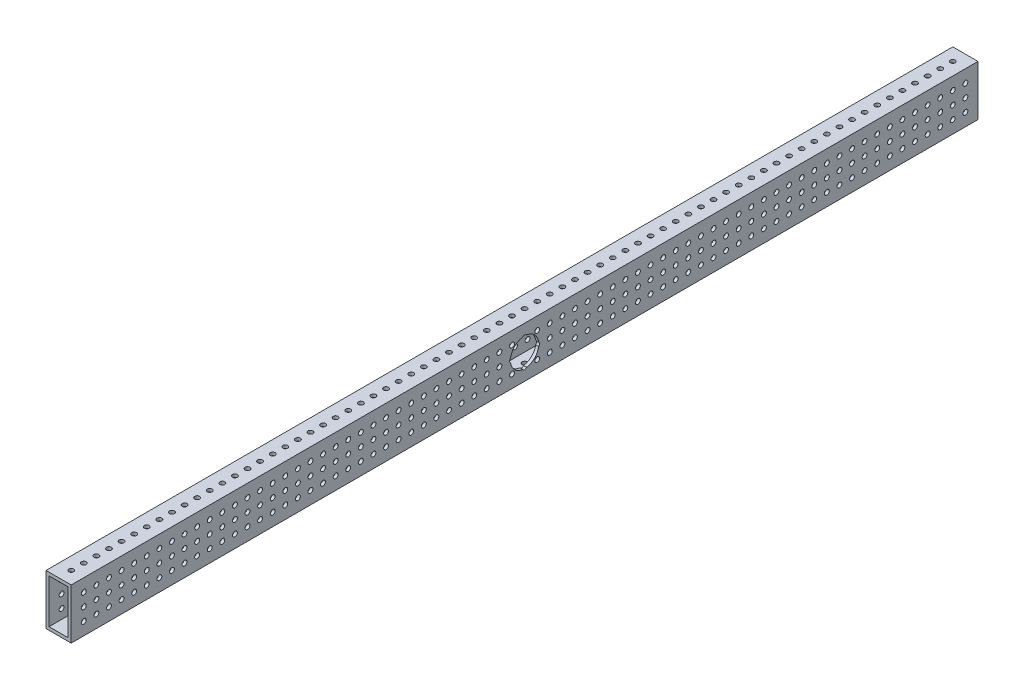
from build123d import *

# Parameters (mm, degrees)
SKETCH1_W             = 25.4
SKETCH1_H             = 50.8
SKETCH1_W_2           = 19.304
SKETCH1_H_2           = 44.45
BOSS_EXTRUDE1_DEPTH   = 457.2
SKETCH2_W             = 2.45745
SKETCH2_H             = 50.8
SKETCH2_AT_POINT_2_W  = 2.45745
SKETCH2_AT_POINT_2_H  = 50.8
SKETCH2_AT_POINT_3_W  = 2.45745
SKETCH2_AT_POINT_3_H  = 50.8
SKETCH2_AT_POINT_4_W  = 2.45745
SKETCH2_AT_POINT_4_H  = 50.8
LPATTERN1_START       = -12.7
LPATTERN1_OUTLINE_R   = 2.45745
LPATTERN1_DEPTH       = 25.4
LPATTERN1_START_2     = -25.4
LPATTERN1_2_OUTLINE_R = 2.45745
LPATTERN1_2_DEPTH     = 50.8
SKETCH3_R             = 14.2875
CUT_EXTRUDE1_DEPTH    = 459.608940166


with BuildPart() as part:
    # Sketch1 → Boss-Extrude1 (new, symmetric)
    with BuildSketch(Plane.XY):
        Rectangle(SKETCH1_W, SKETCH1_H)
        Rectangle(SKETCH1_W_2, SKETCH1_H_2, mode=Mode.SUBTRACT)
    extrude(amount=BOSS_EXTRUDE1_DEPTH, both=True)

    # Sketch2 → #10 (0.1935) Diameter Hole1 (revolve, cut)
    with BuildSketch(Plane(origin=(0, 25.4, 444.5), x_dir=(0, 0, 1), z_dir=(1, 0, 0))):
        with Locations((1.228725, 25.4)):
            Rectangle(SKETCH2_W, SKETCH2_H)
    revolve(axis=Axis((0, 31.75, 444.5), (0, -1, 0)), mode=Mode.SUBTRACT)

    # Sketch2 at point 2 (carried to point 2, square into its face) → #10 (0.1935) Diameter Hole1 at 2 (revolve, cut)
    with BuildSketch(Plane(origin=(12.7, 12.7, 444.5), x_dir=(0, 0, 1), z_dir=(0, -1, 0))):
        with Locations((1.228725, 25.4)):
            Rectangle(SKETCH2_AT_POINT_2_W, SKETCH2_AT_POINT_2_H)
    revolve(axis=Axis((19.05, 12.7, 444.5), (-1, 0, 0)), mode=Mode.SUBTRACT)

    # Sketch2 at point 3 (carried to point 3, square into its face) → #10 (0.1935) Diameter Hole1 at 3 (revolve, cut)
    with BuildSketch(Plane(origin=(12.7, 0, 444.5), x_dir=(0, 0, 1), z_dir=(0, -1, 0))):
        with Locations((1.228725, 25.4)):
            Rectangle(SKETCH2_AT_POINT_3_W, SKETCH2_AT_POINT_3_H)
    revolve(axis=Axis((19.05, 0, 444.5), (-1, 0, 0)), mode=Mode.SUBTRACT)

    # Sketch2 at point 4 (carried to point 4, square into its face) → #10 (0.1935) Diameter Hole1 at 4 (revolve, cut)
    with BuildSketch(Plane(origin=(12.7, -12.7, 444.5), x_dir=(0, 0, 1), z_dir=(0, -1, 0))):
        with Locations((1.228725, 25.4)):
            Rectangle(SKETCH2_AT_POINT_4_W, SKETCH2_AT_POINT_4_H)
    revolve(axis=Axis((19.05, -12.7, 444.5), (-1, 0, 0)), mode=Mode.SUBTRACT)

    # LPattern1: read off the stored shape, not the designer's step
    # LPattern1 outline → LPattern1 (cut)
    with BuildSketch(Plane.YZ.offset(LPATTERN1_START)):
        with Locations((-12.7, 431.8)):
            Circle(LPATTERN1_OUTLINE_R)
        with Locations((0, 431.8)):
            Circle(LPATTERN1_OUTLINE_R)
        with Locations((12.7, 431.8)):
            Circle(LPATTERN1_OUTLINE_R)
        with Locations((-12.7, 419.1)):
            Circle(LPATTERN1_OUTLINE_R)
        with Locations((0, 419.1)):
            Circle(LPATTERN1_OUTLINE_R)
        with Locations((12.7, 419.1)):
            Circle(LPATTERN1_OUTLINE_R)
        with Locations((-12.7, 406.4)):
            Circle(LPATTERN1_OUTLINE_R)
        with Locations((0, 406.4)):
            Circle(LPATTERN1_OUTLINE_R)
        with Locations((12.7, 406.4)):
            Circle(LPATTERN1_OUTLINE_R)
        with Locations((-12.7, 393.7)):
            Circle(LPATTERN1_OUTLINE_R)
        with Locations((0, 393.7)):
            Circle(LPATTERN1_OUTLINE_R)
        with Locations((12.7, 393.7)):
            Circle(LPATTERN1_OUTLINE_R)
        with Locations((-12.7, 381)):
            Circle(LPATTERN1_OUTLINE_R)
        with Locations((0, 381)):
            Circle(LPATTERN1_OUTLINE_R)
        with Locations((12.7, 381)):
            Circle(LPATTERN1_OUTLINE_R)
        with Locations((-12.7, 368.3)):
            Circle(LPATTERN1_OUTLINE_R)
        with Locations((0, 368.3)):
            Circle(LPATTERN1_OUTLINE_R)
        with Locations((12.7, 368.3)):
            Circle(LPATTERN1_OUTLINE_R)
        with Locations((-12.7, 355.6)):
            Circle(LPATTERN1_OUTLINE_R)
        with Locations((0, 355.6)):
            Circle(LPATTERN1_OUTLINE_R)
        with Locations((12.7, 355.6)):
            Circle(LPATTERN1_OUTLINE_R)
        with Locations((-12.7, 342.9)):
            Circle(LPATTERN1_OUTLINE_R)
        with Locations((0, 342.9)):
            Circle(LPATTERN1_OUTLINE_R)
        with Locations((12.7, 342.9)):
            Circle(LPATTERN1_OUTLINE_R)
        with Locations((-12.7, 330.2)):
            Circle(LPATTERN1_OUTLINE_R)
        with Locations((0, 330.2)):
            Circle(LPATTERN1_OUTLINE_R)
        with Locations((12.7, 330.2)):
            Circle(LPATTERN1_OUTLINE_R)
        with Locations((-12.7, 317.5)):
            Circle(LPATTERN1_OUTLINE_R)
        with Locations((0, 317.5)):
            Circle(LPATTERN1_OUTLINE_R)
        with Locations((12.7, 317.5)):
            Circle(LPATTERN1_OUTLINE_R)
        with Locations((-12.7, 304.8)):
            Circle(LPATTERN1_OUTLINE_R)
        with Locations((0, 304.8)):
            Circle(LPATTERN1_OUTLINE_R)
        with Locations((12.7, 304.8)):
            Circle(LPATTERN1_OUTLINE_R)
        with Locations((-12.7, 292.1)):
            Circle(LPATTERN1_OUTLINE_R)
        with Locations((0, 292.1)):
            Circle(LPATTERN1_OUTLINE_R)
        with Locations((12.7, 292.1)):
            Circle(LPATTERN1_OUTLINE_R)
        with Locations((-12.7, 279.4)):
            Circle(LPATTERN1_OUTLINE_R)
        with Locations((0, 279.4)):
            Circle(LPATTERN1_OUTLINE_R)
        with Locations((12.7, 279.4)):
            Circle(LPATTERN1_OUTLINE_R)
        with Locations((-12.7, 266.7)):
            Circle(LPATTERN1_OUTLINE_R)
        with Locations((0, 266.7)):
            Circle(LPATTERN1_OUTLINE_R)
        with Locations((12.7, 266.7)):
            Circle(LPATTERN1_OUTLINE_R)
        with Locations((-12.7, 254)):
            Circle(LPATTERN1_OUTLINE_R)
        with Locations((0, 254)):
            Circle(LPATTERN1_OUTLINE_R)
        with Locations((12.7, 254)):
            Circle(LPATTERN1_OUTLINE_R)
        with Locations((-12.7, 241.3)):
            Circle(LPATTERN1_OUTLINE_R)
        with Locations((0, 241.3)):
            Circle(LPATTERN1_OUTLINE_R)
        with Locations((12.7, 241.3)):
            Circle(LPATTERN1_OUTLINE_R)
        with Locations((-12.7, 228.6)):
            Circle(LPATTERN1_OUTLINE_R)
        with Locations((0, 228.6)):
            Circle(LPATTERN1_OUTLINE_R)
        with Locations((12.7, 228.6)):
            Circle(LPATTERN1_OUTLINE_R)
        with Locations((-12.7, 215.9)):
            Circle(LPATTERN1_OUTLINE_R)
        with Locations((0, 215.9)):
            Circle(LPATTERN1_OUTLINE_R)
        with Locations((12.7, 215.9)):
            Circle(LPATTERN1_OUTLINE_R)
        with Locations((-12.7, 203.2)):
            Circle(LPATTERN1_OUTLINE_R)
        with Locations((0, 203.2)):
            Circle(LPATTERN1_OUTLINE_R)
        with Locations((12.7, 203.2)):
            Circle(LPATTERN1_OUTLINE_R)
        with Locations((-12.7, 190.5)):
            Circle(LPATTERN1_OUTLINE_R)
        with Locations((0, 190.5)):
            Circle(LPATTERN1_OUTLINE_R)
        with Locations((12.7, 190.5)):
            Circle(LPATTERN1_OUTLINE_R)
        with Locations((-12.7, 177.8)):
            Circle(LPATTERN1_OUTLINE_R)
        with Locations((0, 177.8)):
            Circle(LPATTERN1_OUTLINE_R)
        with Locations((12.7, 177.8)):
            Circle(LPATTERN1_OUTLINE_R)
        with Locations((-12.7, 165.1)):
            Circle(LPATTERN1_OUTLINE_R)
        with Locations((0, 165.1)):
            Circle(LPATTERN1_OUTLINE_R)
        with Locations((12.7, 165.1)):
            Circle(LPATTERN1_OUTLINE_R)
        with Locations((-12.7, 152.4)):
            Circle(LPATTERN1_OUTLINE_R)
        with Locations((0, 152.4)):
            Circle(LPATTERN1_OUTLINE_R)
        with Locations((12.7, 152.4)):
            Circle(LPATTERN1_OUTLINE_R)
        with Locations((-12.7, 139.7)):
            Circle(LPATTERN1_OUTLINE_R)
        with Locations((0, 139.7)):
            Circle(LPATTERN1_OUTLINE_R)
        with Locations((12.7, 139.7)):
            Circle(LPATTERN1_OUTLINE_R)
        with Locations((-12.7, 127)):
            Circle(LPATTERN1_OUTLINE_R)
        with Locations((0, 127)):
            Circle(LPATTERN1_OUTLINE_R)
        with Locations((12.7, 127)):
            Circle(LPATTERN1_OUTLINE_R)
        with Locations((-12.7, 114.3)):
            Circle(LPATTERN1_OUTLINE_R)
        with Locations((0, 114.3)):
            Circle(LPATTERN1_OUTLINE_R)
        with Locations((12.7, 114.3)):
            Circle(LPATTERN1_OUTLINE_R)
        with Locations((-12.7, 101.6)):
            Circle(LPATTERN1_OUTLINE_R)
        with Locations((0, 101.6)):
            Circle(LPATTERN1_OUTLINE_R)
        with Locations((12.7, 101.6)):
            Circle(LPATTERN1_OUTLINE_R)
        with Locations((-12.7, 88.9)):
            Circle(LPATTERN1_OUTLINE_R)
        with Locations((0, 88.9)):
            Circle(LPATTERN1_OUTLINE_R)
        with Locations((12.7, 88.9)):
            Circle(LPATTERN1_OUTLINE_R)
        with Locations((-12.7, 76.2)):
            Circle(LPATTERN1_OUTLINE_R)
        with Locations((0, 76.2)):
            Circle(LPATTERN1_OUTLINE_R)
        with Locations((12.7, 76.2)):
            Circle(LPATTERN1_OUTLINE_R)
        with Locations((-12.7, 63.5)):
            Circle(LPATTERN1_OUTLINE_R)
        with Locations((0, 63.5)):
            Circle(LPATTERN1_OUTLINE_R)
        with Locations((12.7, 63.5)):
            Circle(LPATTERN1_OUTLINE_R)
        with Locations((-12.7, 50.8)):
            Circle(LPATTERN1_OUTLINE_R)
        with Locations((0, 50.8)):
            Circle(LPATTERN1_OUTLINE_R)
        with Locations((12.7, 50.8)):
            Circle(LPATTERN1_OUTLINE_R)
        with Locations((-12.7, 38.1)):
            Circle(LPATTERN1_OUTLINE_R)
        with Locations((0, 38.1)):
            Circle(LPATTERN1_OUTLINE_R)
        with Locations((12.7, 38.1)):
            Circle(LPATTERN1_OUTLINE_R)
        with Locations((-12.7, 25.4)):
            Circle(LPATTERN1_OUTLINE_R)
        with Locations((0, 25.4)):
            Circle(LPATTERN1_OUTLINE_R)
        with Locations((12.7, 25.4)):
            Circle(LPATTERN1_OUTLINE_R)
        with Locations((-12.7, 12.7)):
            Circle(LPATTERN1_OUTLINE_R)
        with Locations((0, 12.7)):
            Circle(LPATTERN1_OUTLINE_R)
        with Locations((12.7, 12.7)):
            Circle(LPATTERN1_OUTLINE_R)
        with Locations((-12.7, 0)):
            Circle(LPATTERN1_OUTLINE_R)
        Circle(LPATTERN1_OUTLINE_R)
        with Locations((12.7, 0)):
            Circle(LPATTERN1_OUTLINE_R)
        with Locations((-12.7, -12.7)):
            Circle(LPATTERN1_OUTLINE_R)
        with Locations((0, -12.7)):
            Circle(LPATTERN1_OUTLINE_R)
        with Locations((12.7, -12.7)):
            Circle(LPATTERN1_OUTLINE_R)
        with Locations((-12.7, -25.4)):
            Circle(LPATTERN1_OUTLINE_R)
        with Locations((0, -25.4)):
            Circle(LPATTERN1_OUTLINE_R)
        with Locations((12.7, -25.4)):
            Circle(LPATTERN1_OUTLINE_R)
        with Locations((-12.7, -38.1)):
            Circle(LPATTERN1_OUTLINE_R)
        with Locations((0, -38.1)):
            Circle(LPATTERN1_OUTLINE_R)
        with Locations((12.7, -38.1)):
            Circle(LPATTERN1_OUTLINE_R)
        with Locations((-12.7, -50.8)):
            Circle(LPATTERN1_OUTLINE_R)
        with Locations((0, -50.8)):
            Circle(LPATTERN1_OUTLINE_R)
        with Locations((12.7, -50.8)):
            Circle(LPATTERN1_OUTLINE_R)
        with Locations((-12.7, -63.5)):
            Circle(LPATTERN1_OUTLINE_R)
        with Locations((0, -63.5)):
            Circle(LPATTERN1_OUTLINE_R)
        with Locations((12.7, -63.5)):
            Circle(LPATTERN1_OUTLINE_R)
        with Locations((-12.7, -76.2)):
            Circle(LPATTERN1_OUTLINE_R)
        with Locations((0, -76.2)):
            Circle(LPATTERN1_OUTLINE_R)
        with Locations((12.7, -76.2)):
            Circle(LPATTERN1_OUTLINE_R)
        with Locations((-12.7, -88.9)):
            Circle(LPATTERN1_OUTLINE_R)
        with Locations((0, -88.9)):
            Circle(LPATTERN1_OUTLINE_R)
        with Locations((12.7, -88.9)):
            Circle(LPATTERN1_OUTLINE_R)
        with Locations((-12.7, -101.6)):
            Circle(LPATTERN1_OUTLINE_R)
        with Locations((0, -101.6)):
            Circle(LPATTERN1_OUTLINE_R)
        with Locations((12.7, -101.6)):
            Circle(LPATTERN1_OUTLINE_R)
        with Locations((-12.7, -114.3)):
            Circle(LPATTERN1_OUTLINE_R)
        with Locations((0, -114.3)):
            Circle(LPATTERN1_OUTLINE_R)
        with Locations((12.7, -114.3)):
            Circle(LPATTERN1_OUTLINE_R)
        with Locations((-12.7, -127)):
            Circle(LPATTERN1_OUTLINE_R)
        with Locations((0, -127)):
            Circle(LPATTERN1_OUTLINE_R)
        with Locations((12.7, -127)):
            Circle(LPATTERN1_OUTLINE_R)
        with Locations((-12.7, -139.7)):
            Circle(LPATTERN1_OUTLINE_R)
        with Locations((0, -139.7)):
            Circle(LPATTERN1_OUTLINE_R)
        with Locations((12.7, -139.7)):
            Circle(LPATTERN1_OUTLINE_R)
        with Locations((-12.7, -152.4)):
            Circle(LPATTERN1_OUTLINE_R)
        with Locations((0, -152.4)):
            Circle(LPATTERN1_OUTLINE_R)
        with Locations((12.7, -152.4)):
            Circle(LPATTERN1_OUTLINE_R)
        with Locations((-12.7, -165.1)):
            Circle(LPATTERN1_OUTLINE_R)
        with Locations((0, -165.1)):
            Circle(LPATTERN1_OUTLINE_R)
        with Locations((12.7, -165.1)):
            Circle(LPATTERN1_OUTLINE_R)
        with Locations((-12.7, -177.8)):
            Circle(LPATTERN1_OUTLINE_R)
        with Locations((0, -177.8)):
            Circle(LPATTERN1_OUTLINE_R)
        with Locations((12.7, -177.8)):
            Circle(LPATTERN1_OUTLINE_R)
        with Locations((-12.7, -190.5)):
            Circle(LPATTERN1_OUTLINE_R)
        with Locations((0, -190.5)):
            Circle(LPATTERN1_OUTLINE_R)
        with Locations((12.7, -190.5)):
            Circle(LPATTERN1_OUTLINE_R)
        with Locations((-12.7, -203.2)):
            Circle(LPATTERN1_OUTLINE_R)
        with Locations((0, -203.2)):
            Circle(LPATTERN1_OUTLINE_R)
        with Locations((12.7, -203.2)):
            Circle(LPATTERN1_OUTLINE_R)
        with Locations((-12.7, -215.9)):
            Circle(LPATTERN1_OUTLINE_R)
        with Locations((0, -215.9)):
            Circle(LPATTERN1_OUTLINE_R)
        with Locations((12.7, -215.9)):
            Circle(LPATTERN1_OUTLINE_R)
        with Locations((-12.7, -228.6)):
            Circle(LPATTERN1_OUTLINE_R)
        with Locations((0, -228.6)):
            Circle(LPATTERN1_OUTLINE_R)
        with Locations((12.7, -228.6)):
            Circle(LPATTERN1_OUTLINE_R)
        with Locations((-12.7, -241.3)):
            Circle(LPATTERN1_OUTLINE_R)
        with Locations((0, -241.3)):
            Circle(LPATTERN1_OUTLINE_R)
        with Locations((12.7, -241.3)):
            Circle(LPATTERN1_OUTLINE_R)
        with Locations((-12.7, -254)):
            Circle(LPATTERN1_OUTLINE_R)
        with Locations((0, -254)):
            Circle(LPATTERN1_OUTLINE_R)
        with Locations((12.7, -254)):
            Circle(LPATTERN1_OUTLINE_R)
        with Locations((-12.7, -266.7)):
            Circle(LPATTERN1_OUTLINE_R)
        with Locations((0, -266.7)):
            Circle(LPATTERN1_OUTLINE_R)
        with Locations((12.7, -266.7)):
            Circle(LPATTERN1_OUTLINE_R)
        with Locations((-12.7, -279.4)):
            Circle(LPATTERN1_OUTLINE_R)
        with Locations((0, -279.4)):
            Circle(LPATTERN1_OUTLINE_R)
        with Locations((12.7, -279.4)):
            Circle(LPATTERN1_OUTLINE_R)
        with Locations((-12.7, -292.1)):
            Circle(LPATTERN1_OUTLINE_R)
        with Locations((0, -292.1)):
            Circle(LPATTERN1_OUTLINE_R)
        with Locations((12.7, -292.1)):
            Circle(LPATTERN1_OUTLINE_R)
        with Locations((-12.7, -304.8)):
            Circle(LPATTERN1_OUTLINE_R)
        with Locations((0, -304.8)):
            Circle(LPATTERN1_OUTLINE_R)
        with Locations((12.7, -304.8)):
            Circle(LPATTERN1_OUTLINE_R)
        with Locations((-12.7, -317.5)):
            Circle(LPATTERN1_OUTLINE_R)
        with Locations((0, -317.5)):
            Circle(LPATTERN1_OUTLINE_R)
        with Locations((12.7, -317.5)):
            Circle(LPATTERN1_OUTLINE_R)
        with Locations((-12.7, -330.2)):
            Circle(LPATTERN1_OUTLINE_R)
        with Locations((0, -330.2)):
            Circle(LPATTERN1_OUTLINE_R)
        with Locations((12.7, -330.2)):
            Circle(LPATTERN1_OUTLINE_R)
        with Locations((-12.7, -342.9)):
            Circle(LPATTERN1_OUTLINE_R)
        with Locations((0, -342.9)):
            Circle(LPATTERN1_OUTLINE_R)
        with Locations((12.7, -342.9)):
            Circle(LPATTERN1_OUTLINE_R)
        with Locations((-12.7, -355.6)):
            Circle(LPATTERN1_OUTLINE_R)
        with Locations((0, -355.6)):
            Circle(LPATTERN1_OUTLINE_R)
        with Locations((12.7, -355.6)):
            Circle(LPATTERN1_OUTLINE_R)
        with Locations((-12.7, -368.3)):
            Circle(LPATTERN1_OUTLINE_R)
        with Locations((0, -368.3)):
            Circle(LPATTERN1_OUTLINE_R)
        with Locations((12.7, -368.3)):
            Circle(LPATTERN1_OUTLINE_R)
        with Locations((-12.7, -381)):
            Circle(LPATTERN1_OUTLINE_R)
        with Locations((0, -381)):
            Circle(LPATTERN1_OUTLINE_R)
        with Locations((12.7, -381)):
            Circle(LPATTERN1_OUTLINE_R)
        with Locations((-12.7, -393.7)):
            Circle(LPATTERN1_OUTLINE_R)
        with Locations((0, -393.7)):
            Circle(LPATTERN1_OUTLINE_R)
        with Locations((12.7, -393.7)):
            Circle(LPATTERN1_OUTLINE_R)
        with Locations((-12.7, -406.4)):
            Circle(LPATTERN1_OUTLINE_R)
        with Locations((0, -406.4)):
            Circle(LPATTERN1_OUTLINE_R)
        with Locations((12.7, -406.4)):
            Circle(LPATTERN1_OUTLINE_R)
        with Locations((-12.7, -419.1)):
            Circle(LPATTERN1_OUTLINE_R)
        with Locations((0, -419.1)):
            Circle(LPATTERN1_OUTLINE_R)
        with Locations((12.7, -419.1)):
            Circle(LPATTERN1_OUTLINE_R)
        with Locations((-12.7, -431.8)):
            Circle(LPATTERN1_OUTLINE_R)
        with Locations((0, -431.8)):
            Circle(LPATTERN1_OUTLINE_R)
        with Locations((12.7, -431.8)):
            Circle(LPATTERN1_OUTLINE_R)
        with Locations((-12.7, -444.5)):
            Circle(LPATTERN1_OUTLINE_R)
        with Locations((0, -444.5)):
            Circle(LPATTERN1_OUTLINE_R)
        with Locations((12.7, -444.5)):
            Circle(LPATTERN1_OUTLINE_R)
    extrude(amount=LPATTERN1_DEPTH, mode=Mode.SUBTRACT)

    # LPattern1 2 outline → LPattern1 2 (cut)
    with BuildSketch(Plane(origin=(0, 0, 0), x_dir=(1, 0, 0), z_dir=(0, 1, 0)).offset(LPATTERN1_START_2)):
        with Locations((0, -431.8)):
            Circle(LPATTERN1_2_OUTLINE_R)
        with Locations((0, -419.1)):
            Circle(LPATTERN1_2_OUTLINE_R)
        with Locations((0, -406.4)):
            Circle(LPATTERN1_2_OUTLINE_R)
        with Locations((0, -393.7)):
            Circle(LPATTERN1_2_OUTLINE_R)
        with Locations((0, -381)):
            Circle(LPATTERN1_2_OUTLINE_R)
        with Locations((0, -368.3)):
            Circle(LPATTERN1_2_OUTLINE_R)
        with Locations((0, -355.6)):
            Circle(LPATTERN1_2_OUTLINE_R)
        with Locations((0, -342.9)):
            Circle(LPATTERN1_2_OUTLINE_R)
        with Locations((0, -330.2)):
            Circle(LPATTERN1_2_OUTLINE_R)
        with Locations((0, -317.5)):
            Circle(LPATTERN1_2_OUTLINE_R)
        with Locations((0, -304.8)):
            Circle(LPATTERN1_2_OUTLINE_R)
        with Locations((0, -292.1)):
            Circle(LPATTERN1_2_OUTLINE_R)
        with Locations((0, -279.4)):
            Circle(LPATTERN1_2_OUTLINE_R)
        with Locations((0, -266.7)):
            Circle(LPATTERN1_2_OUTLINE_R)
        with Locations((0, -254)):
            Circle(LPATTERN1_2_OUTLINE_R)
        with Locations((0, -241.3)):
            Circle(LPATTERN1_2_OUTLINE_R)
        with Locations((0, -228.6)):
            Circle(LPATTERN1_2_OUTLINE_R)
        with Locations((0, -215.9)):
            Circle(LPATTERN1_2_OUTLINE_R)
        with Locations((0, -203.2)):
            Circle(LPATTERN1_2_OUTLINE_R)
        with Locations((0, -190.5)):
            Circle(LPATTERN1_2_OUTLINE_R)
        with Locations((0, -177.8)):
            Circle(LPATTERN1_2_OUTLINE_R)
        with Locations((0, -165.1)):
            Circle(LPATTERN1_2_OUTLINE_R)
        with Locations((0, -152.4)):
            Circle(LPATTERN1_2_OUTLINE_R)
        with Locations((0, -139.7)):
            Circle(LPATTERN1_2_OUTLINE_R)
        with Locations((0, -127)):
            Circle(LPATTERN1_2_OUTLINE_R)
        with Locations((0, -114.3)):
            Circle(LPATTERN1_2_OUTLINE_R)
        with Locations((0, -101.6)):
            Circle(LPATTERN1_2_OUTLINE_R)
        with Locations((0, -88.9)):
            Circle(LPATTERN1_2_OUTLINE_R)
        with Locations((0, -76.2)):
            Circle(LPATTERN1_2_OUTLINE_R)
        with Locations((0, -63.5)):
            Circle(LPATTERN1_2_OUTLINE_R)
        with Locations((0, -50.8)):
            Circle(LPATTERN1_2_OUTLINE_R)
        with Locations((0, -38.1)):
            Circle(LPATTERN1_2_OUTLINE_R)
        with Locations((0, -25.4)):
            Circle(LPATTERN1_2_OUTLINE_R)
        with Locations((0, -12.7)):
            Circle(LPATTERN1_2_OUTLINE_R)
        Circle(LPATTERN1_2_OUTLINE_R)
        with Locations((0, 12.7)):
            Circle(LPATTERN1_2_OUTLINE_R)
        with Locations((0, 25.4)):
            Circle(LPATTERN1_2_OUTLINE_R)
        with Locations((0, 38.1)):
            Circle(LPATTERN1_2_OUTLINE_R)
        with Locations((0, 50.8)):
            Circle(LPATTERN1_2_OUTLINE_R)
        with Locations((0, 63.5)):
            Circle(LPATTERN1_2_OUTLINE_R)
        with Locations((0, 76.2)):
            Circle(LPATTERN1_2_OUTLINE_R)
        with Locations((0, 88.9)):
            Circle(LPATTERN1_2_OUTLINE_R)
        with Locations((0, 101.6)):
            Circle(LPATTERN1_2_OUTLINE_R)
        with Locations((0, 114.3)):
            Circle(LPATTERN1_2_OUTLINE_R)
        with Locations((0, 127)):
            Circle(LPATTERN1_2_OUTLINE_R)
        with Locations((0, 139.7)):
            Circle(LPATTERN1_2_OUTLINE_R)
        with Locations((0, 152.4)):
            Circle(LPATTERN1_2_OUTLINE_R)
        with Locations((0, 165.1)):
            Circle(LPATTERN1_2_OUTLINE_R)
        with Locations((0, 177.8)):
            Circle(LPATTERN1_2_OUTLINE_R)
        with Locations((0, 190.5)):
            Circle(LPATTERN1_2_OUTLINE_R)
        with Locations((0, 203.2)):
            Circle(LPATTERN1_2_OUTLINE_R)
        with Locations((0, 215.9)):
            Circle(LPATTERN1_2_OUTLINE_R)
        with Locations((0, 228.6)):
            Circle(LPATTERN1_2_OUTLINE_R)
        with Locations((0, 241.3)):
            Circle(LPATTERN1_2_OUTLINE_R)
        with Locations((0, 254)):
            Circle(LPATTERN1_2_OUTLINE_R)
        with Locations((0, 266.7)):
            Circle(LPATTERN1_2_OUTLINE_R)
        with Locations((0, 279.4)):
            Circle(LPATTERN1_2_OUTLINE_R)
        with Locations((0, 292.1)):
            Circle(LPATTERN1_2_OUTLINE_R)
        with Locations((0, 304.8)):
            Circle(LPATTERN1_2_OUTLINE_R)
        with Locations((0, 317.5)):
            Circle(LPATTERN1_2_OUTLINE_R)
        with Locations((0, 330.2)):
            Circle(LPATTERN1_2_OUTLINE_R)
        with Locations((0, 342.9)):
            Circle(LPATTERN1_2_OUTLINE_R)
        with Locations((0, 355.6)):
            Circle(LPATTERN1_2_OUTLINE_R)
        with Locations((0, 368.3)):
            Circle(LPATTERN1_2_OUTLINE_R)
        with Locations((0, 381)):
            Circle(LPATTERN1_2_OUTLINE_R)
        with Locations((0, 393.7)):
            Circle(LPATTERN1_2_OUTLINE_R)
        with Locations((0, 406.4)):
            Circle(LPATTERN1_2_OUTLINE_R)
        with Locations((0, 419.1)):
            Circle(LPATTERN1_2_OUTLINE_R)
        with Locations((0, 431.8)):
            Circle(LPATTERN1_2_OUTLINE_R)
        with Locations((0, 444.5)):
            Circle(LPATTERN1_2_OUTLINE_R)
    extrude(amount=LPATTERN1_2_DEPTH, mode=Mode.SUBTRACT)

    # Sketch3 → Cut-Extrude1 (cut, through all)
    with BuildSketch(Plane(origin=(12.7, 0, 0), x_dir=(0, 0, -1), z_dir=(1, 0, 0))):
        Circle(SKETCH3_R)
    extrude(amount=-CUT_EXTRUDE1_DEPTH, mode=Mode.SUBTRACT)


solid = part.part
